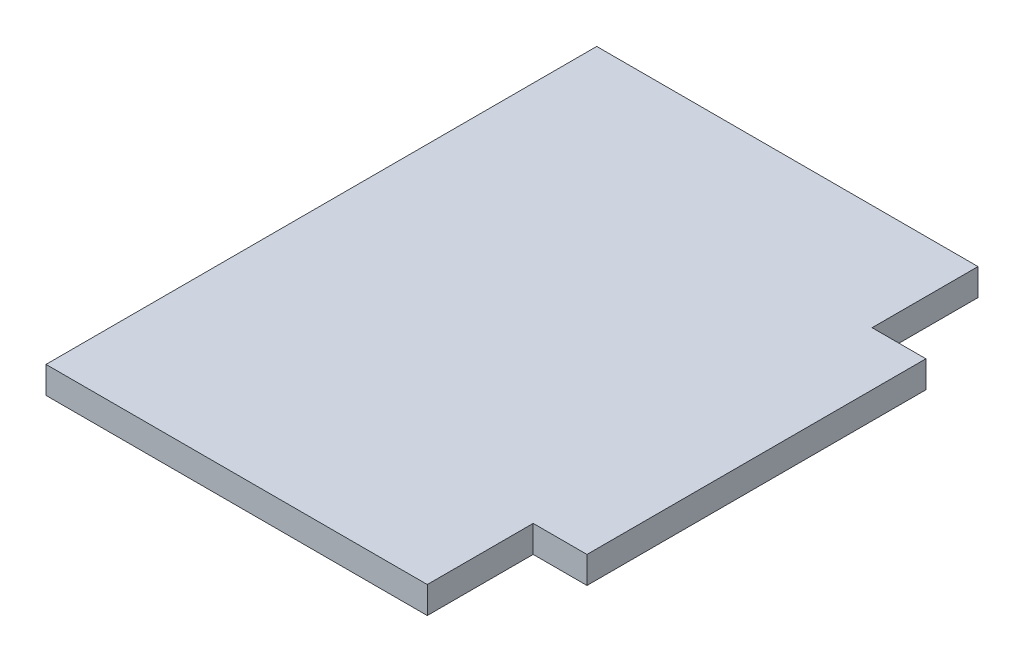
from build123d import *

# Parameters (mm, degrees)
BOSS_EXTRUDE1_DEPTH = 3.175


with BuildPart() as part:
    # Sketch1 → Boss-Extrude1 (new body)
    with BuildSketch(Plane(origin=(0, 0, 0), x_dir=(1, 0, 0), z_dir=(0, 1, 0))):
        Polygon((22.5, 12.5), (-22.5, 12.5), (-22.5, 0), (-22.5, -40), (-22.5, -52.5), (22.5, -52.5), (22.5, -40), (28.85, -40), (28.85, 0), (22.5, 0), align=None)
    extrude(amount=BOSS_EXTRUDE1_DEPTH)


solid = part.part
